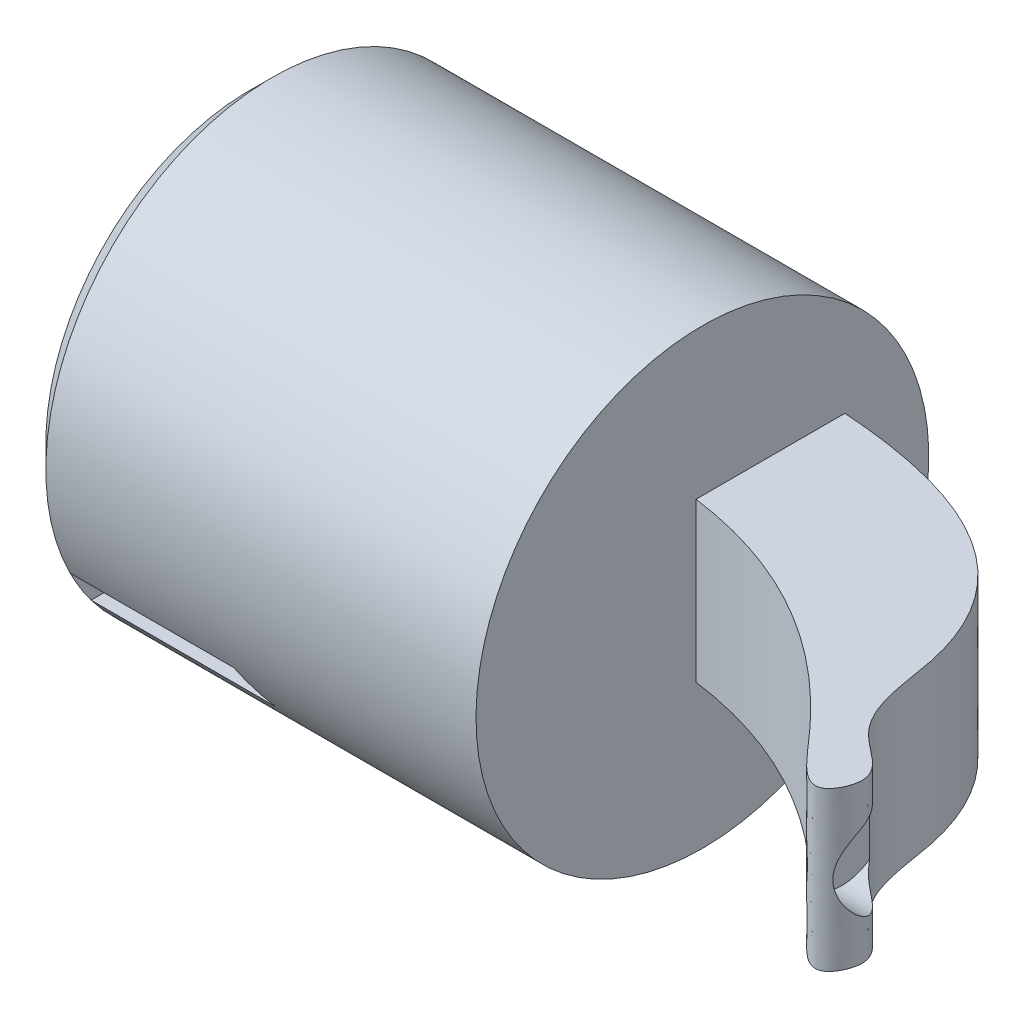
from build123d import *

# Parameters (mm, degrees)
SKETCH1_R           = 10
BOSS_EXTRUDE1_DEPTH = 20
BOSS_EXTRUDE3_DEPTH = 3.5
CHAMFER1_SIZE       = 1
CUT_EXTRUDE3_START  = -6
CUT_EXTRUDE3_DEPTH  = 1.5
CUT_EXTRUDE4_START  = 20
SKETCH6_R           = 2
CUT_EXTRUDE4_DEPTH  = 7.5


with BuildPart() as part:
    # Sketch1 → Boss-Extrude1 (new body)
    with BuildSketch(Plane(origin=(0, 0, 0), x_dir=(0, 0, -1), z_dir=(1, 0, 0))):
        Circle(SKETCH1_R)
    extrude(amount=-BOSS_EXTRUDE1_DEPTH)

    # Sketch2 → Boss-Extrude3 (add, symmetric)
    with BuildSketch(Plane(origin=(0, 0, 0), x_dir=(1, 0, 0), z_dir=(0, 1, 0))):
        with BuildLine():
            Line((-20, 4.552541281), (-20, -4.652556813))
            add(Edge.make_bspline(
                [(-20, 4.552541281), (-5.332044775, 6.728820811), (11.350234113, 9.203964857), (11.750268252, -5.329655387), (14.900457271, -6.762458374), (13.663458635, -9.408843589), (3.071558707, 4.260280029), (-8.929597587, -0.375919428), (-20, -4.652556813)],
                knots=[0, 0, 0, 0, 0.428983644, 0.487895189, 0.520452124, 0.537439316, 0.573313372, 1, 1, 1, 1], degree=3))
        make_face()
    extrude(amount=BOSS_EXTRUDE3_DEPTH, both=True)

    # Chamfer1
    chamfer1_edges = [part.edges().sort_by_distance(p)[0] for p in [
        (-20, 0, 10),
    ]]
    chamfer(chamfer1_edges, length=CHAMFER1_SIZE)

    # Sketch5 → Cut-Extrude3 (cut)
    with BuildSketch(Plane(origin=(0, 0, 0), x_dir=(1, 0, 0), z_dir=(0, 1, 0)).offset(CUT_EXTRUDE3_START)):
        Polygon((3.048983105, 10), (1.625511126, -4.531383911), (1.625511126, -2.562752449), (0.626052076, -1.563293399), (0.626052076, 0), (1.625511126, 0.738491079), (1.625511126, 2.797982454), (1.684164139, 3.396736392), (1.684164139, 4.524320812), (-12.840156673, -10), (-19, -10), (-19, 10), align=None)
    extrude(amount=CUT_EXTRUDE3_DEPTH, mode=Mode.SUBTRACT)

    # Sketch6 → Cut-Extrude4 (cut, symmetric)
    with BuildSketch(Plane(origin=(0, 0, 0), x_dir=(0, 0, -1), z_dir=(1, 0, 0)).offset(CUT_EXTRUDE4_START)):
        with Locations((-6.317251447, 0)):
            Circle(SKETCH6_R)
    extrude(amount=CUT_EXTRUDE4_DEPTH, both=True, mode=Mode.SUBTRACT)


solid = part.part
